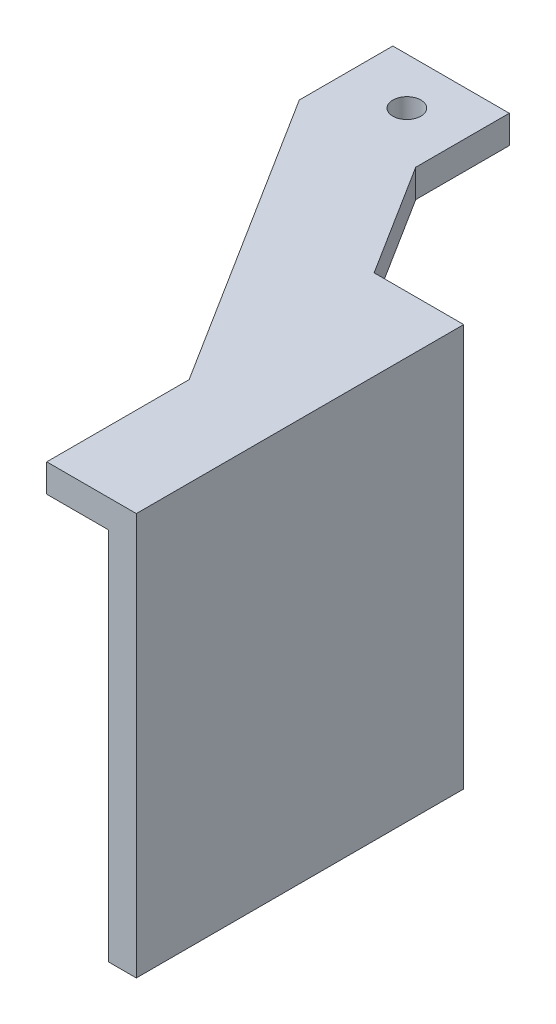
from build123d import *

# Parameters (mm, degrees)
BOSS_EXTRUDE1_DEPTH = 3
SKETCH3_W           = 3
SKETCH3_H           = 35
BOSS_EXTRUDE2_DEPTH = 40
BOSS_EXTRUDE3_DEPTH = 3
SKETCH2_R           = 1.5
CUT_EXTRUDE1_DEPTH  = 3
CUT_EXTRUDE3_DEPTH  = 6.5


with BuildPart() as part:
    # Sketch1 → Boss-Extrude1 (new body)
    with BuildSketch(Plane(origin=(0, 0, 0), x_dir=(1, 0, 0), z_dir=(0, 1, 0))):
        Polygon((10, -5), (10, -52), (19.57850172, -52), (19.57850172, 5), (10, 5), (-10, 5), (-10, -5), align=None)
    extrude(amount=BOSS_EXTRUDE1_DEPTH)

    # Sketch3 → Boss-Extrude2 (add)
    with BuildSketch(Plane.XZ):
        with Locations((18.07850172, 34.5)):
            Rectangle(SKETCH3_W, SKETCH3_H)
    extrude(amount=BOSS_EXTRUDE2_DEPTH)

    # Sketch4 → Boss-Extrude3 (add)
    with BuildSketch(Plane(origin=(0, 0, 0), x_dir=(1, 0, 0), z_dir=(0, 1, 0))):
        Polygon((-10, 5), (-10, -5), (19.57850172, -52), (19.57850172, -17), (10, -17), (2.448042114, -5), (2.448042114, 5), align=None)
    extrude(amount=BOSS_EXTRUDE3_DEPTH)

    # Sketch2 → Cut-Extrude1 (cut)
    with BuildSketch(Plane(origin=(0, 3, 0), x_dir=(1, 0, 0), z_dir=(0, 1, 0))):
        with Locations((-3.5, 0)):
            Circle(SKETCH2_R)
    extrude(amount=-CUT_EXTRUDE1_DEPTH, mode=Mode.SUBTRACT)

    # Sketch5 → Cut-Extrude3 (cut, symmetric)
    with BuildSketch(Plane(origin=(0, 0, 0), x_dir=(1, 0, 0), z_dir=(0, 1, 0))):
        Polygon((2.448042114, 5), (19.57850172, 5), (19.57850172, -17), (10, -17), (2.448042114, -5), align=None)
    extrude(amount=CUT_EXTRUDE3_DEPTH, both=True, mode=Mode.SUBTRACT)


solid = part.part
